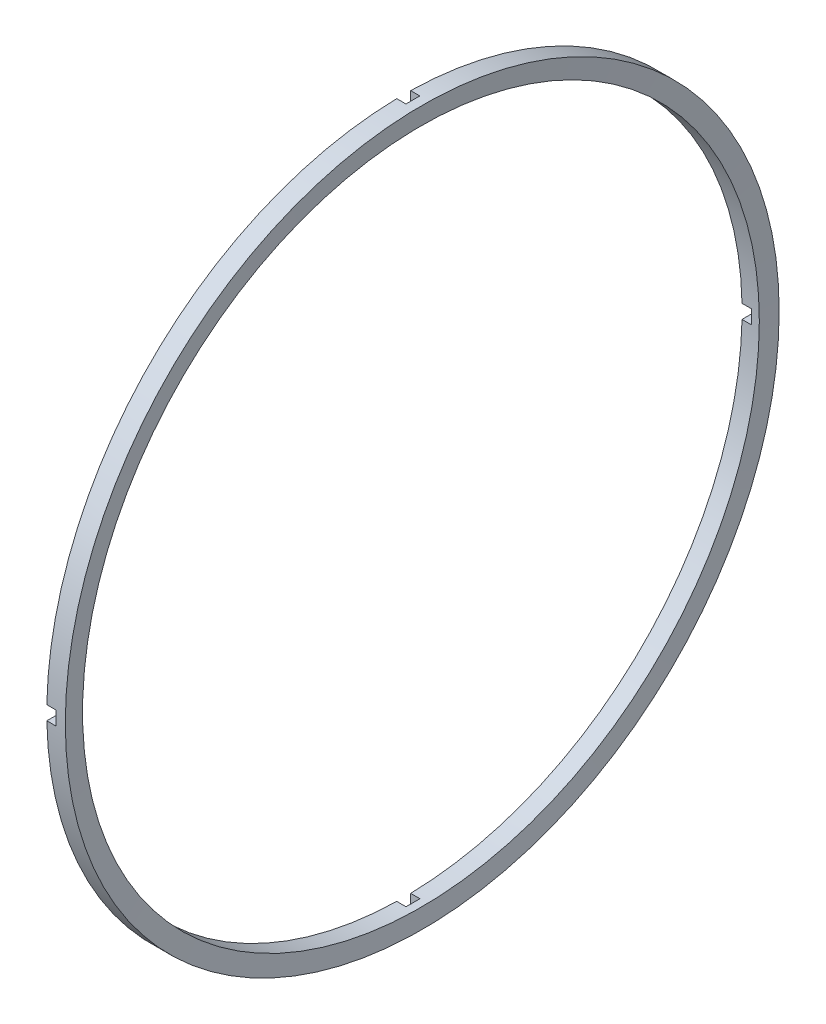
from build123d import *

# Parameters (mm, degrees)
ODEBRAT_VYSUNUT_M1_DEPTH = 1


with BuildPart() as part:
    # Skica1 → Rotovat1 (revolve)
    with BuildSketch(Plane.XY):
        Polygon((-19.64396546, 38.5), (-19.64396546, 36.5), (-17.783819083, 36.5), (-17.64396546, 38.5), align=None)
    revolve(axis=Axis((0, 0, 0), (-1, 0, 0)))

    # Skica2 → Odebrat vysunutím1 (cut)
    with BuildSketch(Plane.ZY.offset(19.64396546)):
        Polygon((-0.75, -38.5), (0.75, -38.5), (0.75, -0.75), (38.5, -0.75), (38.5, 0.75), (0.75, 0.75), (0.75, 38.5), (-0.75, 38.5), (-0.75, 0.75), (-38.5, 0.75), (-38.5, -0.75), (-0.75, -0.75), align=None)
    extrude(amount=-ODEBRAT_VYSUNUT_M1_DEPTH, mode=Mode.SUBTRACT)


solid = part.part
